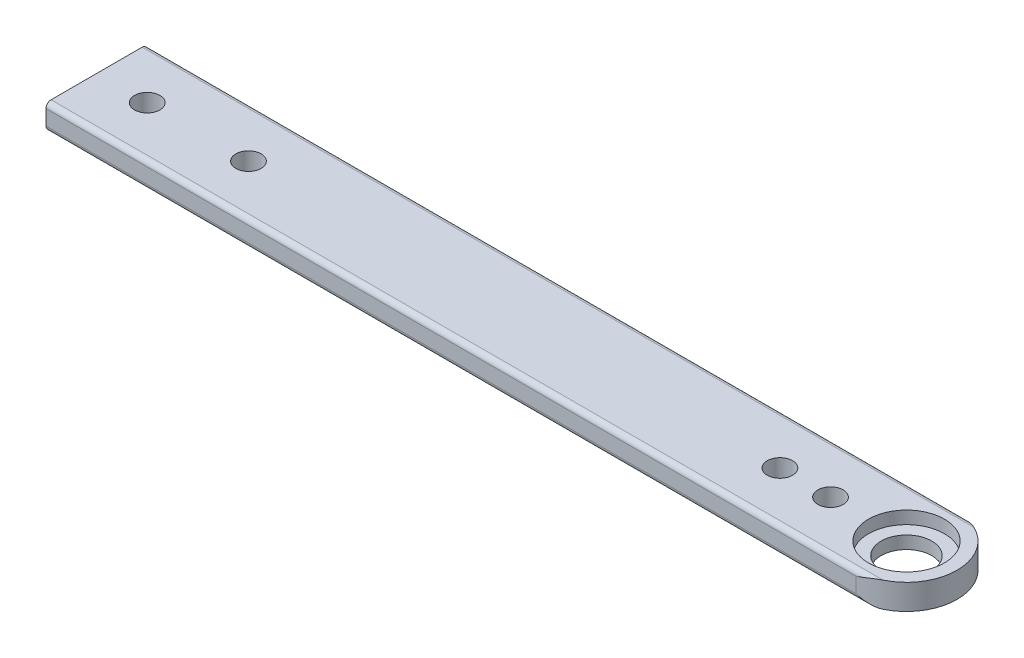
from build123d import *

# Parameters (mm, degrees)
SKETCH1_W           = 215.9
SKETCH1_H           = 25.4
BOSS_EXTRUDE1_DEPTH = 6.35
FILLET1_R           = 1.27
SKETCH2_R           = 3.175
SKETCH2_R_2         = 6.35
CUT_EXTRUDE1_DEPTH  = 109.879819067
SKETCH3_R           = 9.525
CUT_EXTRUDE2_DEPTH  = 3.175
SKETCH4_R           = 3.175
CUT_EXTRUDE3_DEPTH  = 109.879819067
CUT_EXTRUDE4_DEPTH  = 109.879819067


with BuildPart() as part:
    # Sketch1 → Boss-Extrude1 (new body)
    with BuildSketch(Plane(origin=(0, 0, 0), x_dir=(1, 0, 0), z_dir=(0, 1, 0))):
        Rectangle(SKETCH1_W, SKETCH1_H)
    extrude(amount=BOSS_EXTRUDE1_DEPTH)

    # Fillet1
    fillet1_edges = [part.edges().sort_by_distance(p)[0] for p in [
        (0, 0, -12.7),
        (0, 6.35, -12.7),
        (0, 0, 12.7),
        (0, 6.35, 12.7),
    ]]
    fillet(fillet1_edges, radius=FILLET1_R)

    # Sketch2 → Cut-Extrude1 (cut, through all)
    with BuildSketch(Plane(origin=(0, 6.35, 0), x_dir=(1, 0, 0), z_dir=(0, 1, 0))):
        with Locations((-95.25, 0)):
            Circle(SKETCH2_R)
        with Locations((95.25, 0)):
            Circle(SKETCH2_R_2)
        with Locations((-69.85, 0)):
            Circle(SKETCH2_R)
    extrude(amount=-CUT_EXTRUDE1_DEPTH, mode=Mode.SUBTRACT)

    # Sketch3 → Cut-Extrude2 (cut)
    with BuildSketch(Plane(origin=(0, 6.35, 0), x_dir=(1, 0, 0), z_dir=(0, 1, 0))):
        with Locations((95.25, 0)):
            Circle(SKETCH3_R)
    extrude(amount=-CUT_EXTRUDE2_DEPTH, mode=Mode.SUBTRACT)

    # Sketch4 → Cut-Extrude3 (cut, through all)
    with BuildSketch(Plane(origin=(0, 6.35, 0), x_dir=(1, 0, 0), z_dir=(0, 1, 0))):
        with Locations((76.2, 0)):
            Circle(SKETCH4_R)
        with Locations((63.5, 0)):
            Circle(SKETCH4_R)
    extrude(amount=-CUT_EXTRUDE3_DEPTH, mode=Mode.SUBTRACT)

    # Sketch5 → Cut-Extrude4 (cut, through all)
    with BuildSketch(Plane(origin=(0, 6.35, 0), x_dir=(1, 0, 0), z_dir=(0, 1, 0))):
        with BuildLine():
            Line((95.25, -12.7), (107.95, -12.7))
            Line((107.95, -12.7), (107.95, 0))
            ThreePointArc((107.95, 0), (104.230256121, -8.980256121), (95.25, -12.7))
        make_face()
        with BuildLine():
            Line((107.95, 0), (107.95, 12.7))
            Line((107.95, 12.7), (95.25, 12.7))
            ThreePointArc((95.25, 12.7), (104.230256121, 8.980256121), (107.95, 0))
        make_face()
    extrude(amount=-CUT_EXTRUDE4_DEPTH, mode=Mode.SUBTRACT)


solid = part.part
